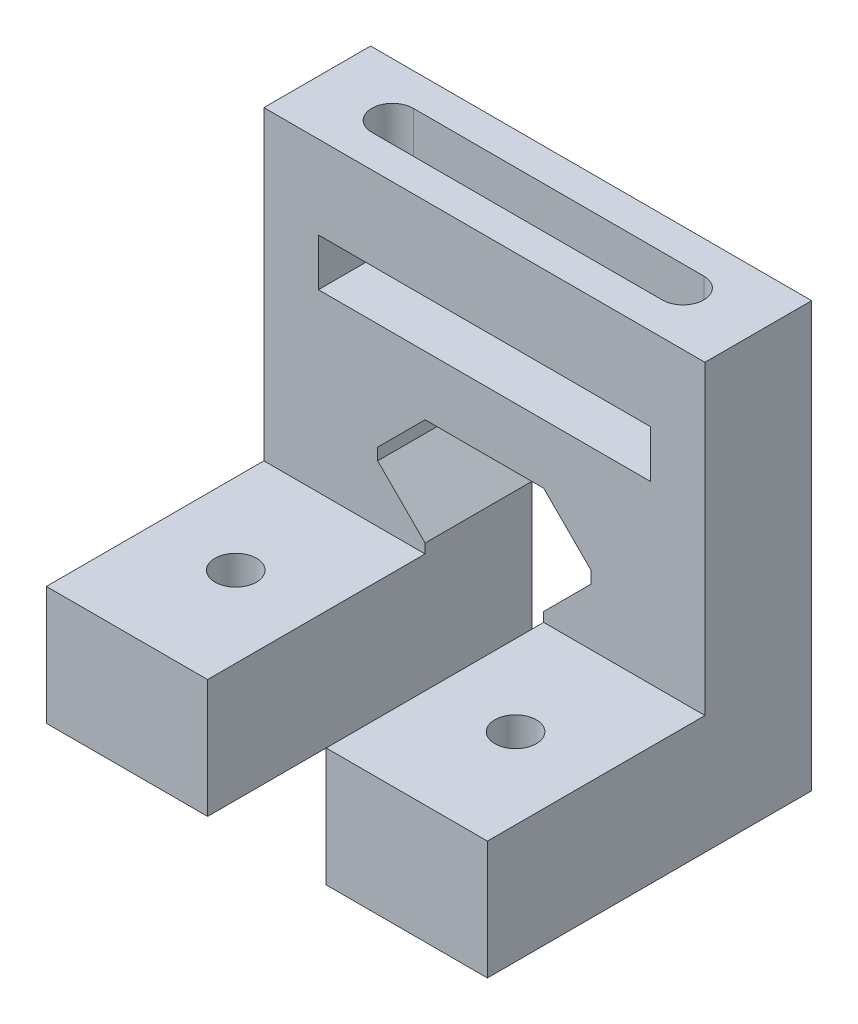
from build123d import *

# Parameters (mm, degrees)
SKETCH1_W             = 13.6
SKETCH1_H             = 27.345
BOSS_EXTRUDE1_DEPTH   = 10
BOSS_EXTRUDE1_2_DEPTH = 10
BOSS_EXTRUDE2_DEPTH   = 9
SKETCH3_R             = 1.75
CUT_EXTRUDE1_DEPTH    = 53.888836487
SKETCH6_W             = 28
SKETCH6_H             = 4
CUT_EXTRUDE2_DEPTH    = 59.422846772
CUT_EXTRUDE3_REACH    = 60.423
CUT_EXTRUDE4_START    = -9
SKETCH8_W             = 18
SKETCH8_H             = 5
CUT_EXTRUDE4_DEPTH    = 9
CHAMFER2_SIZE         = 4


with BuildPart() as part:
    # Sketch1 → Boss-Extrude1 (new body)
    with BuildSketch(Plane(origin=(0, 0, 0), x_dir=(1, 0, 0), z_dir=(0, 1, 0))):
        with Locations((6.8, 13.6725)):
            Rectangle(SKETCH1_W, SKETCH1_H)
    extrude(amount=BOSS_EXTRUDE1_DEPTH)



with BuildPart() as body_2:
    # Sketch1 → Boss-Extrude1 2 (new body)
    with BuildSketch(Plane(origin=(0, 0, 0), x_dir=(1, 0, 0), z_dir=(0, 1, 0))):
        with Locations((30.4, 13.6725)):
            Rectangle(SKETCH1_W, SKETCH1_H)
    extrude(amount=BOSS_EXTRUDE1_2_DEPTH)


with BuildPart() as part_1:
    add(part.part)

    add(body_2.part)  # Boss-Extrude2 merges body 2
    # Sketch2 → Boss-Extrude2 (add)
    with BuildSketch(Plane(origin=(0, 0, -27.345), x_dir=(-1, 0, 0), z_dir=(0, 0, -1))):
        Polygon((-37.2, 35.8), (-37.2, 10), (-31.1, 22), (-31.1, 35.8), align=None)
        Polygon((-31.1, 22), (-37.2, 10), (-31.1, 10), align=None)
        Polygon((-31.1, 35.8), (-31.1, 22), (-31.1, 10), (-23.6, 10), (-23.6, 19.8), (-13.6, 19.8), (-13.6, 10), (-6.1, 10), (-6.1, 22), (-6.1, 35.8), align=None)
        Polygon((0, 35.8), (-6.1, 35.8), (-6.1, 22), (0, 10), align=None)
        Polygon((0, 10), (-6.1, 22), (-6.1, 10), align=None)
    extrude(amount=-BOSS_EXTRUDE2_DEPTH)

    # Sketch3 → Cut-Extrude1 (cut, through all)
    with BuildSketch(Plane(origin=(0, 10, 0), x_dir=(1, 0, 0), z_dir=(0, 1, 0))):
        with Locations(Location((30.4, 9.1725, 0), (0, 0, 270))):
            Circle(SKETCH3_R)
        with Locations(Location((6.8, 9.1725, 0), (0, 0, 90))):
            Circle(SKETCH3_R)
    extrude(amount=-CUT_EXTRUDE1_DEPTH, mode=Mode.SUBTRACT)

    # Sketch6 → Cut-Extrude2 (cut, through all)
    with BuildSketch(Plane(origin=(0, 0, -27.345), x_dir=(-1, 0, 0), z_dir=(0, 0, -1))):
        with Locations((-18.6, 26.8)):
            Rectangle(SKETCH6_W, SKETCH6_H)
    extrude(amount=-CUT_EXTRUDE2_DEPTH, mode=Mode.SUBTRACT)

    # Sketch5 → Cut-Extrude3 (cut, up to next)
    with BuildSketch(Plane(origin=(0, 35.8, 0), x_dir=(1, 0, 0), z_dir=(0, 1, 0)), mode=Mode.PRIVATE) as cut_extrude3_sk1:
        with BuildLine():
            Line((6.35, 24.595), (30.85, 24.595))
            ThreePointArc((30.85, 24.595), (32.6, 22.845), (30.85, 21.095))
            Line((30.85, 21.095), (6.35, 21.095))
            ThreePointArc((6.35, 21.095), (4.6, 22.845), (6.35, 24.595))
        make_face()
    cut_extrude3_tool1 = extrude(cut_extrude3_sk1.sketch, amount=-CUT_EXTRUDE3_REACH, mode=Mode.PRIVATE) & part_1.part
    add(cut_extrude3_tool1.solids().sort_by_distance((18.6, 35.8, -22.845))[0], mode=Mode.SUBTRACT)

    # Sketch8 → Cut-Extrude4 (cut)
    with BuildSketch(Plane.XY.offset(-18.345).offset(CUT_EXTRUDE4_START)):
        with Locations((18.6, 17.3)):
            Rectangle(SKETCH8_W, SKETCH8_H)
    extrude(amount=CUT_EXTRUDE4_DEPTH, mode=Mode.SUBTRACT)

    # Chamfer2
    chamfer2_edges = [part_1.edges().sort_by_distance(p)[0] for p in [
        (27.6, 19.8, -22.845),
        (9.6, 19.8, -22.845),
    ]]
    chamfer(chamfer2_edges, length=CHAMFER2_SIZE)
    chamfer2_2_edges = [part_1.edges().sort_by_distance(p)[0] for p in [
        (23.6, 14.8, -22.845),
        (13.6, 14.8, -22.845),
    ]]
    chamfer(chamfer2_2_edges, length=CHAMFER2_SIZE - 0.0001)  # a hair under: the kernel refuses the full size


solid = part_1.part
